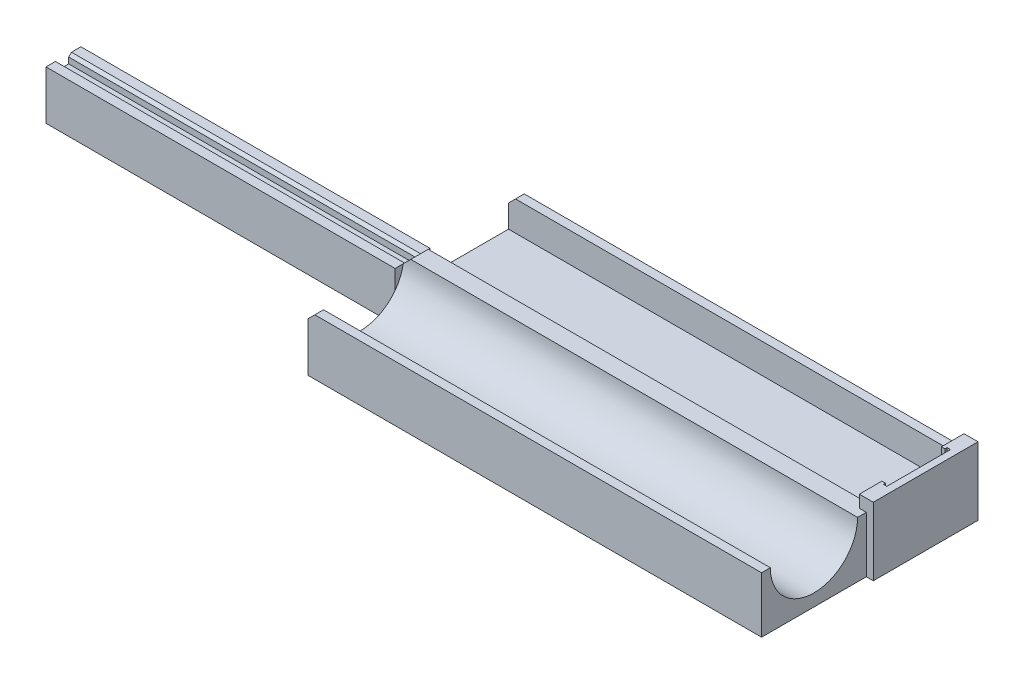
from build123d import *

# Parameters (mm, degrees)
SKETCH1_W            = 130
SKETCH1_H            = 60
BOSS_EXTRUDE1_DEPTH  = 16
CUT_EXTRUDE1_DEPTH   = 135.372616258
SKETCH3_W            = 18.25
SKETCH3_H            = 5.5
CUT_EXTRUDE2_DEPTH   = 2
BOSS_EXTRUDE2_START  = -2
SKETCH3_7_W          = 0.6
SKETCH3_7_H          = 4.9
SKETCH3_7_H_2        = 3.5
BOSS_EXTRUDE2_DEPTH  = 1
SKETCH3_9_W          = 5.875
SKETCH3_9_H          = 3.5
SKETCH3_9_W_2        = 0.6
SKETCH3_9_H_2        = 4.9
SKETCH3_9_W_3        = 17.05
SKETCH3_9_H_3        = 0.6
BOSS_EXTRUDE3_DEPTH  = 2
SKETCH3_10_W         = 5.875
SKETCH3_10_H         = 3.5
BOSS_EXTRUDE4_DEPTH  = 2
SKETCH4_W            = 25
SKETCH4_H            = 8.5
SKETCH4_H_2          = 6.5
CUT_EXTRUDE3_DEPTH   = 128
BOSS_EXTRUDE10_DEPTH = 100
CHAMFER1_SIZE        = 0.8
CHAMFER2_SIZE        = 2


with BuildPart() as part:
    # Sketch1 → Boss-Extrude1 (new body)
    with BuildSketch(Plane(origin=(0, 0, 0), x_dir=(1, 0, 0), z_dir=(0, 1, 0))):
        Rectangle(SKETCH1_W, SKETCH1_H)
    extrude(amount=BOSS_EXTRUDE1_DEPTH)

    # Sketch2 → Cut-Extrude1 (cut, through all)
    with BuildSketch(Plane(origin=(65, 0, 0), x_dir=(0, 0, -1), z_dir=(1, 0, 0))):
        with BuildLine():
            ThreePointArc((-27.5, 16), (-15, 3.5), (-2.5, 16))
            Line((-2.5, 16), (-27.5, 16))
        make_face()
        with BuildLine():
            Line((-27.5, 16), (-2.5, 16))
            ThreePointArc((-2.5, 16), (-15, 28.5), (-27.5, 16))
        make_face()
    extrude(amount=-CUT_EXTRUDE1_DEPTH, mode=Mode.SUBTRACT)

    # Sketch3 → Cut-Extrude2 (cut)
    with BuildSketch(Plane(origin=(65, 0, 0), x_dir=(0, 0, -1), z_dir=(1, 0, 0))):
        with Locations((15, 13.25)):
            Rectangle(SKETCH3_W, SKETCH3_H)
    extrude(amount=-CUT_EXTRUDE2_DEPTH, mode=Mode.SUBTRACT)

    # Sketch3<7> → Boss-Extrude2 (add)
    with BuildSketch(Plane(origin=(65, 0, 0), x_dir=(0, 0, -1), z_dir=(1, 0, 0)).offset(BOSS_EXTRUDE2_START)):
        with Locations((23.825, 13.55)):
            Rectangle(SKETCH3_7_W, SKETCH3_7_H)
        with Locations((23.825, 17.75)):
            Rectangle(SKETCH3_7_W, SKETCH3_7_H_2)
        with Locations((6.175, 17.75)):
            Rectangle(SKETCH3_7_W, SKETCH3_7_H_2)
        with Locations((6.175, 13.55)):
            Rectangle(SKETCH3_7_W, SKETCH3_7_H)
    extrude(amount=BOSS_EXTRUDE2_DEPTH)

    # Sketch3<9> → Boss-Extrude3 (add)
    with BuildSketch(Plane(origin=(65, 0, 0), x_dir=(0, 0, -1), z_dir=(1, 0, 0))):
        with Locations((2.9375, 17.75)):
            Rectangle(SKETCH3_9_W, SKETCH3_9_H)
        Polygon((0, 0), (30, 0), (30, 16), (24.125, 16), (24.125, 11.1), (24.125, 10.5), (23.525, 10.5), (6.475, 10.5), (5.875, 10.5), (5.875, 11.1), (5.875, 16), (0, 16), align=None)
        with Locations((6.175, 13.55)):
            Rectangle(SKETCH3_9_W_2, SKETCH3_9_H_2)
        with Locations((15, 13.55)):
            Rectangle(SKETCH3_9_W_3, SKETCH3_9_H_2)
        with Locations((6.175, 17.75)):
            Rectangle(SKETCH3_9_W_2, SKETCH3_9_H)
        with Locations((15, 17.75)):
            Rectangle(SKETCH3_9_W_3, SKETCH3_9_H)
        with Locations((15, 10.8)):
            Rectangle(SKETCH3_9_W_3, SKETCH3_9_H_3)
        with Locations((6.175, 10.8)):
            Rectangle(SKETCH3_9_W_2, SKETCH3_9_H_3)
        with Locations((23.825, 13.55)):
            Rectangle(SKETCH3_9_W_2, SKETCH3_9_H_2)
        with Locations((23.825, 10.8)):
            Rectangle(SKETCH3_9_W_2, SKETCH3_9_H_3)
        with Locations((23.825, 17.75)):
            Rectangle(SKETCH3_9_W_2, SKETCH3_9_H)
        with Locations((27.0625, 17.75)):
            Rectangle(SKETCH3_9_W, SKETCH3_9_H)
    extrude(amount=BOSS_EXTRUDE3_DEPTH)

    # Sketch3<10> → Boss-Extrude4 (add)
    with BuildSketch(Plane(origin=(65, 0, 0), x_dir=(0, 0, -1), z_dir=(1, 0, 0))):
        with Locations((2.9375, 17.75)):
            Rectangle(SKETCH3_10_W, SKETCH3_10_H)
        with Locations((27.0625, 17.75)):
            Rectangle(SKETCH3_10_W, SKETCH3_10_H)
    extrude(amount=-BOSS_EXTRUDE4_DEPTH)

    # Sketch4 → Cut-Extrude3 (cut)
    with BuildSketch(Plane.ZY.offset(65)):
        with Locations((-15, 11.75)):
            Rectangle(SKETCH4_W, SKETCH4_H)
        with Locations((-15, 19.25)):
            Rectangle(SKETCH4_W, SKETCH4_H_2)
    extrude(amount=-CUT_EXTRUDE3_DEPTH, mode=Mode.SUBTRACT)

    # Sketch5 → Boss-Extrude10 (add)
    with BuildSketch(Plane.ZY.offset(65)):
        Polygon((1.5, 14), (1.5, 11.5), (-1.5, 11.5), (-1.5, 14), (-5, 14), (-5, 0), (5, 0), (5, 14), align=None)
    extrude(amount=BOSS_EXTRUDE10_DEPTH)

    # Chamfer1
    chamfer1_edges = [part.edges().sort_by_distance(p)[0] for p in [
        (-115, 14, -1.5),
        (-115, 14, 1.5),
    ]]
    chamfer(chamfer1_edges, length=CHAMFER1_SIZE)

    # Chamfer2
    chamfer2_edges = [part.edges().sort_by_distance(p)[0] for p in [
        (-65, 16, -28.75),
        (-65, 16, 28.75),
        (-65, 16, 0),
    ]]
    chamfer(chamfer2_edges, length=CHAMFER2_SIZE - 0.0001)  # a hair under: the kernel refuses the full size


solid = part.part
